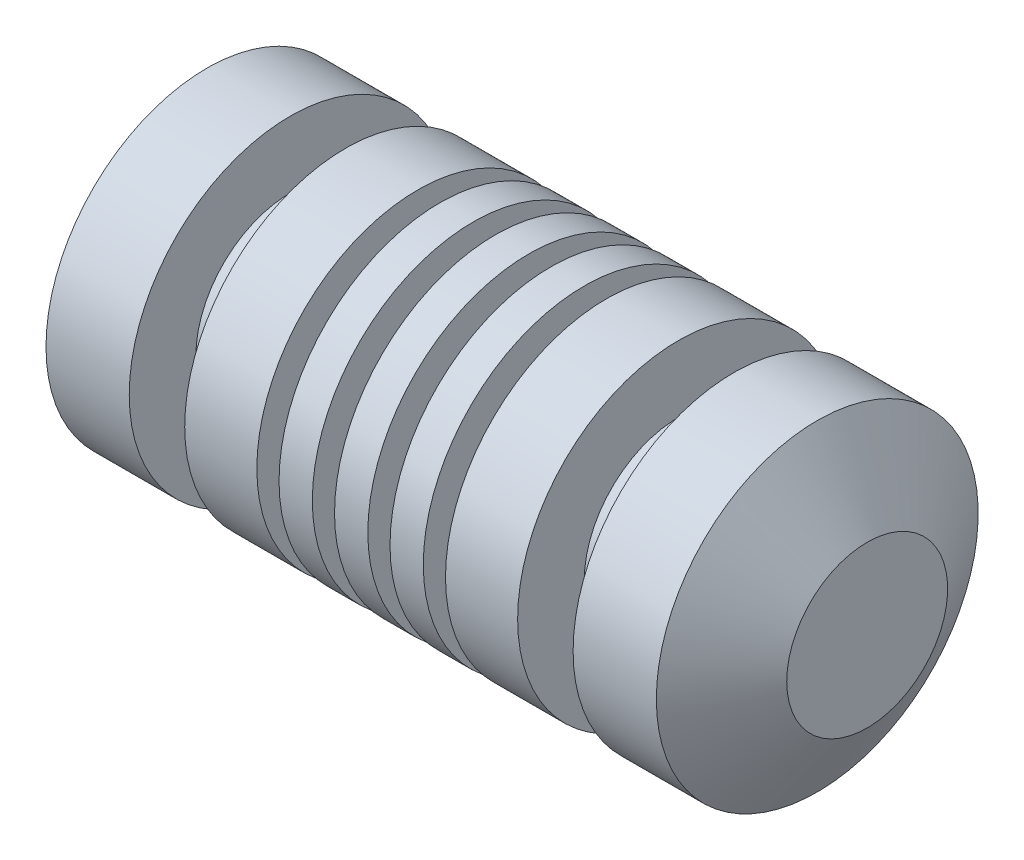
from build123d import *


with BuildPart() as part:
    # Sketch1 → Revolve5 (revolve)
    with BuildSketch(Plane.XY):
        Polygon((0, 0), (151.13, 0), (151.13, 18.415), (139.700007257, 36.83), (120.650007257, 36.83), (120.650007257, 21.59), (107.950007257, 21.59), (107.950007257, 36.83), (91.440007257, 36.83), (91.440007257, 29.21), (86.360007257, 29.21), (86.360007257, 36.83), (78.740007257, 36.83), (78.740007257, 29.21), (73.660007257, 29.21), (73.660007257, 36.83), (66.040007257, 36.83), (66.040007257, 29.21), (60.960007257, 29.21), (60.960007257, 36.83), (53.340007257, 36.83), (53.340007257, 29.21), (48.260007257, 29.21), (48.260007257, 36.83), (31.750007257, 36.83), (31.750007257, 21.59), (19.050007257, 21.59), (19.050007257, 36.83), (0, 36.83), align=None)
    revolve(axis=Axis((0, 0, 0), (1, 0, 0)))


solid = part.part
